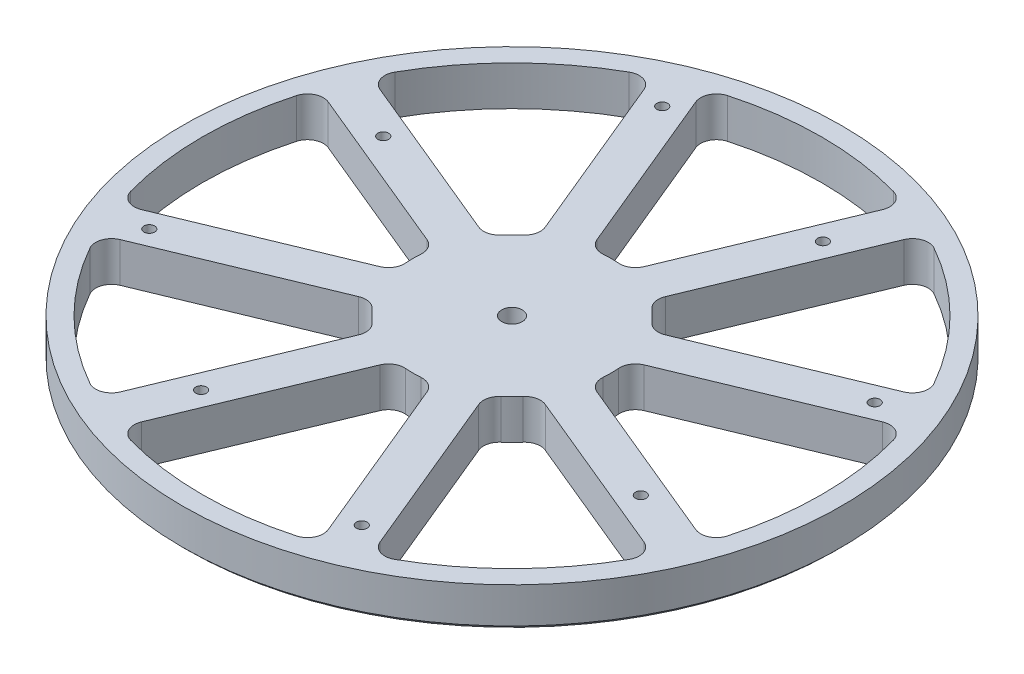
from build123d import *

# Parameters (mm, degrees)
SKETCH2_W                  = 83.09991
SKETCH2_H                  = 10
F_6_32_TAPPED_HOLE1_D      = 2.7051
CIRPATTERN3_COUNT          = 4
CUT_EXTRUDE1_DEPTH         = 118.945708205
FILLET1_R                  = 4
CIRPATTERN4_COUNT          = 8
FILLET1_OF_CIRPATTERN4_R   = 4
CHAMFER2_SIZE              = 1
F_6_0_204_DIAMETER_HOLE2_D = 5.1816


with BuildPart() as part:
    # Sketch2 → Revolve1 (revolve)
    with BuildSketch(Plane(origin=(0, 0, 0), x_dir=(0, 0, -1), z_dir=(1, 0, 0))):
        with Locations((-41.549955, 5)):
            Rectangle(SKETCH2_W, SKETCH2_H)
    revolve(axis=Axis((0, -0.5, 0), (0, 1, 0)))

    # #6-32 Tapped Hole1 (through all)
    with Locations(Plane(origin=(0, 10, 0), x_dir=(1, 0, 0), z_dir=(0, 1, 0))):
        with Locations((-26.787840266, 64.671567276), (-55.432771951, 22.961005942)):
            f_6_32_tapped_hole1 = Hole(F_6_32_TAPPED_HOLE1_D / 2)

    # CirPattern3: #6-32 Tapped Hole1 ×4 about axis
    cirpattern3_axis = Axis((0, -0.5, 0), (0, 1, 0))
    for i in range(1, CIRPATTERN3_COUNT):
        add(f_6_32_tapped_hole1.rotate(cirpattern3_axis, i * 360 / CIRPATTERN3_COUNT), mode=Mode.SUBTRACT)

    # Sketch8 → Cut-Extrude1 (cut, through all)
    with BuildSketch(Plane(origin=(0, 10, 0), x_dir=(1, 0, 0), z_dir=(0, 1, 0))):
        with BuildLine():
            Line((-4.754393761, 24.543751546), (-25.206832056, 73.920305463))
            ThreePointArc((-25.206832056, 73.920305463), (0, 78.09991), (25.206832056, 73.920305463))
            Line((25.206832056, 73.920305463), (4.754393761, 24.543751546))
            ThreePointArc((4.754393761, 24.543751546), (0, 25), (-4.754393761, 24.543751546))
        make_face()
    cut_extrude1 = extrude(amount=-CUT_EXTRUDE1_DEPTH, mode=Mode.SUBTRACT)

    # Fillet1
    fillet1_edges = [part.edges().sort_by_distance(p)[0] for p in [
        (4.754393761, 5, -24.543751546),
        (25.206832056, 5, -73.920305463),
        (-4.754393761, 5, -24.543751546),
        (-25.206832056, 5, -73.920305463),
    ]]
    fillet(fillet1_edges, radius=FILLET1_R)

    # CirPattern4: Cut-Extrude1 ×8 about axis
    cirpattern4_axis = Axis((0, -0.5, 0), (0, 1, 0))
    for i in range(1, CIRPATTERN4_COUNT):
        add(cut_extrude1.rotate(cirpattern4_axis, i * 360 / CIRPATTERN4_COUNT), mode=Mode.SUBTRACT)

    # Fillet1 of CirPattern4
    fillet1_of_cirpattern4_edges = [part.edges().sort_by_distance(p)[0] for p in [
        (-13.993189086, 5, -20.716917223),
        (-34.445627381, 5, -70.093471139),
        (-20.716917223, 5, -13.993189086),
        (-70.093471139, 5, -34.445627381),
        (-24.543751546, 5, -4.754393761),
        (-73.920305463, 5, -25.206832056),
        (-24.543751546, 5, 4.754393761),
        (-73.920305463, 5, 25.206832056),
        (-20.716917223, 5, 13.993189086),
        (-70.093471139, 5, 34.445627381),
        (-13.993189086, 5, 20.716917223),
        (-34.445627381, 5, 70.093471139),
        (-4.754393761, 5, 24.543751546),
        (-25.206832056, 5, 73.920305463),
        (4.754393761, 5, 24.543751546),
        (25.206832056, 5, 73.920305463),
        (13.993189086, 5, 20.716917223),
        (34.445627381, 5, 70.093471139),
        (20.716917223, 5, 13.993189086),
        (70.093471139, 5, 34.445627381),
        (24.543751546, 5, 4.754393761),
        (73.920305463, 5, 25.206832056),
        (24.543751546, 5, -4.754393761),
        (73.920305463, 5, -25.206832056),
        (20.716917223, 5, -13.993189086),
        (70.093471139, 5, -34.445627381),
        (13.993189086, 5, -20.716917223),
        (34.445627381, 5, -70.093471139),
    ]]
    fillet(fillet1_of_cirpattern4_edges, radius=FILLET1_OF_CIRPATTERN4_R)

    # Chamfer2
    chamfer2_edges = [part.edges().sort_by_distance(p)[0] for p in [
        (0, 0, -83.09991),
    ]]
    chamfer(chamfer2_edges, length=CHAMFER2_SIZE)

    # #6 (0.204) Diameter Hole2 (through all)
    with Locations(Plane(origin=(0, 0, 0), x_dir=(-1, 0, 0), z_dir=(0, -1, 0))):
        with Locations((0, 0)):
            Hole(F_6_0_204_DIAMETER_HOLE2_D / 2)


solid = part.part
